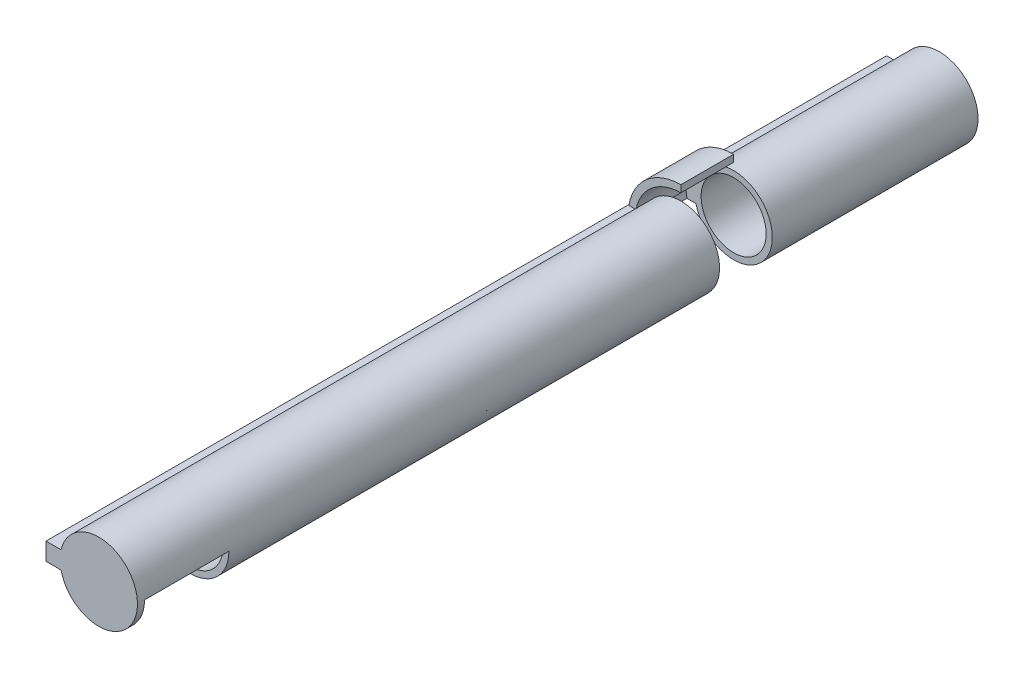
from build123d import *
from build123d.topology import SkipClean

# Parameters (mm, degrees)
SCHIZZO1_R                    = 11
SCHIZZO1_R_2                  = 9.25
TUBO_DEPTH                    = 210
INGRESSOCAVI_DEPTH            = 27
SCHIZZO4_R                    = 11
SCHIZZO4_R_2                  = 6.5
FONDOCORSA_DEPTH              = 3
SCHIZZO5_R                    = 11
TAPPO_DEPTH                   = 2
BASEINFERIORE_DEPTH           = 239
SCHIZZO7_R                    = 13.5
TAGLIOANELLO_DEPTH            = 15
SUPPORTOANELLO_DEPTH          = 15
FACILITAZIONEUSCITACAVI_DEPTH = 3
RACCORDOFACILITAZIONECAVI_R   = 8


with BuildPart() as part:
    # Schizzo1 → Tubo (new body)
    with BuildSketch(Plane.XY):
        Circle(SCHIZZO1_R)
        Circle(SCHIZZO1_R_2, mode=Mode.SUBTRACT)
    extrude(amount=TUBO_DEPTH)

    # Schizzo2 → IngressoCavi (add)
    with BuildSketch(Plane.XY.offset(210)):
        with BuildLine():
            Line((0, -9.25), (0, -11))
            ThreePointArc((0, -11), (-7.778174593, 7.778174593), (11, 0))
            Line((11, 0), (9.25, 0))
            ThreePointArc((9.25, 0), (-6.540737726, 6.540737726), (0, -9.25))
        make_face()
    extrude(amount=INGRESSOCAVI_DEPTH)

    # Schizzo4 → FondoCorsa (add)
    with SkipClean():  # the faces are left unmerged after this step: merging them gives an invalid solid
        with BuildSketch(Plane.XY.offset(210)):
            Circle(SCHIZZO4_R)
            Circle(SCHIZZO4_R_2, mode=Mode.SUBTRACT)
        extrude(amount=FONDOCORSA_DEPTH)

    # Schizzo5 → Tappo (add)
    with SkipClean():  # the faces are left unmerged after this step: merging them gives an invalid solid
        with BuildSketch(Plane.XY.offset(237)):
            Circle(SCHIZZO5_R)
        extrude(amount=TAPPO_DEPTH)
    add(part.part.scale(1), mode=Mode.REPLACE)  # the faces are merged on a copy

    # Schizzo6 → BaseInferiore (add)
    with SkipClean():  # the faces are left unmerged after this step: merging them gives an invalid solid
        with BuildSketch(Plane.XY):
            Polygon((-11, 2.5), (-15, 2.5), (-15, -2.5), (-11, -2.5), (-10.712142643, -2.5), (-10.712142643, 2.5), align=None)
        extrude(amount=BASEINFERIORE_DEPTH)

    # Schizzo7 → TaglioAnello (cut)
    with BuildSketch(Plane.XY.offset(73.5)):
        Circle(SCHIZZO7_R)
    extrude(amount=-TAGLIOANELLO_DEPTH, mode=Mode.SUBTRACT)

    # Schizzo8 → SupportoAnello (add)
    with SkipClean():  # the faces are left unmerged after this step: merging them gives an invalid solid
        with BuildSketch(Plane.XY.offset(73.5)):
            with BuildLine():
                Line((0, 15), (0, 13))
                ThreePointArc((0, 13), (-9.192388155, 9.192388155), (-13, 0))
                Line((-13, 0), (-15, 0))
                ThreePointArc((-15, 0), (-10.606601718, 10.606601718), (0, 15))
            make_face()
        extrude(amount=-SUPPORTOANELLO_DEPTH)

    # Schizzo9 → FacilitazioneUscitaCavi (cut)
    with SkipClean():  # the faces are left unmerged after this step: merging them gives an invalid solid
        with BuildSketch(Plane(origin=(0, 0, 210), x_dir=(-1, 0, 0), z_dir=(0, 0, -1))):
            with BuildLine():
                Line((0, 0), (-9.25, 0))
                ThreePointArc((-9.25, 0), (-6.540737726, -6.540737726), (0, -9.25))
                Line((0, -9.25), (0, 0))
            make_face()
        extrude(amount=-FACILITAZIONEUSCITACAVI_DEPTH, mode=Mode.SUBTRACT)

    # RaccordoFacilitazioneCavi
    # the kernel refuses this fillet: 8 mm, written as the material it takes off along each edge
    with BuildSketch(Plane(origin=(6.5, 0, 201.530207244), x_dir=(1, 0, 0), z_dir=(0, 0, 1)), Plane(origin=(0, -6.5, 221.469792756), x_dir=(0, -1, 0), z_dir=(0, 0, -1))) as raccordofacilitazionecavi_piece_1:
        with BuildLine():
            CenterArc((6.030405405, 7.296501927), RACCORDOFACILITAZIONECAVI_R, 210.212403153, 35.579578639)
            Line((-0.882921715, 3.270845692), (-1.021188257, 3.190332567))
            ThreePointArc((-1.021188257, 3.190332567), (-0.379082322, 1.65226111), (-0.16, 0))
            Line((-0.16, 0), (0, -0.16))
            ThreePointArc((0, -0.16), (1.375, -0.16), (2.684391892, -0.145930039))
            Line((2.684391892, -0.145930039), (2.75, 0))
        make_face()
    extrude(amount=19.939585512, mode=Mode.SUBTRACT)


solid = part.part
